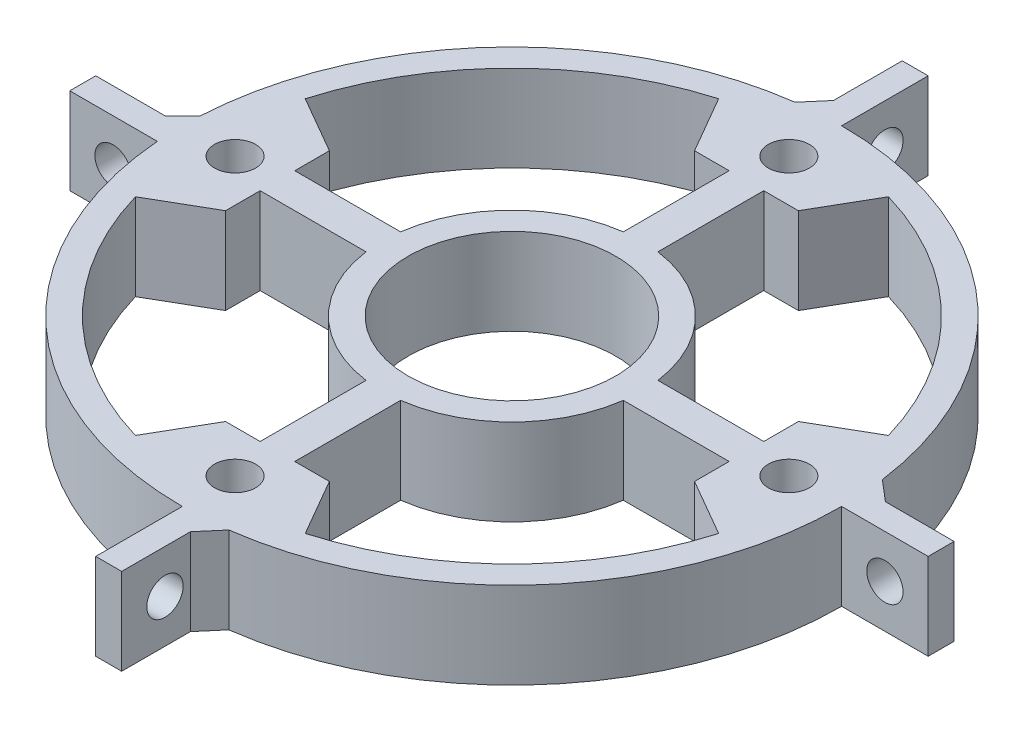
from build123d import *

# Parameters (mm, degrees)
SKETCH1_R           = 38.1
SKETCH1_R_2         = 35.1
EXTRUDE_THIN1_DEPTH = 5
BOSS_EXTRUDE1_START = -10
BOSS_EXTRUDE1_DEPTH = 10
SKETCH3_R           = 2.375
CUT_EXTRUDE1_DEPTH  = 10
CIRPATTERN1_COUNT   = 4
SKETCH4_W           = 11
SKETCH4_H           = 10
BOSS_EXTRUDE2_DEPTH = 3
SKETCH5_R           = 2.1
CUT_EXTRUDE2_DEPTH  = 3
CIRPATTERN2_COUNT   = 4
CHAMFER1_SIZE       = 2.178281406
CHAMFER1_SIZE_2     = 2
SKETCH6_R           = 12
BOSS_EXTRUDE3_DEPTH = 5


with BuildPart() as part:
    # Sketch1 → Extrude-Thin1 (new, symmetric)
    with BuildSketch(Plane(origin=(0, 0, 0), x_dir=(1, 0, 0), z_dir=(0, 1, 0))):
        Circle(SKETCH1_R)
        Circle(SKETCH1_R_2, mode=Mode.SUBTRACT)
    extrude(amount=EXTRUDE_THIN1_DEPTH, both=True)

    # Sketch2 → Boss-Extrude1 (add)
    with BuildSketch(Plane(origin=(0, 5, 0), x_dir=(1, 0, 0), z_dir=(0, 1, 0)).offset(BOSS_EXTRUDE1_START)):
        with BuildLine():
            Line((-27.1, 6), (-27.1, -6))
            Line((-27.1, -6), (-33.700938133, -9.811053408))
            ThreePointArc((-33.700938133, -9.811053408), (-35.1, 0), (-33.700938133, 9.811053408))
            Line((-33.700938133, 9.811053408), (-27.1, 6))
        make_face()
    boss_extrude1 = extrude(amount=BOSS_EXTRUDE1_DEPTH)

    # Sketch3 → Cut-Extrude1 (cut)
    with BuildSketch(Plane(origin=(0, 5, 0), x_dir=(1, 0, 0), z_dir=(0, 1, 0))):
        with Locations(Location((-32, 0, 0), (0, 0, 270))):
            Circle(SKETCH3_R)
    cut_extrude1 = extrude(amount=-CUT_EXTRUDE1_DEPTH, mode=Mode.SUBTRACT)

    # CirPattern1: Boss-Extrude1, Cut-Extrude1 ×4 about axis
    cirpattern1_axis = Axis((0, 0, 0), (0, 1, 0))
    add([boss_extrude1.rotate(cirpattern1_axis, i * 360 / CIRPATTERN1_COUNT) for i in range(1, CIRPATTERN1_COUNT)])
    add([cut_extrude1.rotate(cirpattern1_axis, i * 360 / CIRPATTERN1_COUNT) for i in range(1, CIRPATTERN1_COUNT)], mode=Mode.SUBTRACT)

    # Sketch4 → Boss-Extrude2 (add)
    with BuildSketch(Plane.XY):
        with Locations((-42.6, 0)):
            Rectangle(SKETCH4_W, SKETCH4_H)
    boss_extrude2 = extrude(amount=BOSS_EXTRUDE2_DEPTH)

    # Sketch5 → Cut-Extrude2 (cut)
    with BuildSketch(Plane(origin=(0, 0, 0), x_dir=(-1, 0, 0), z_dir=(0, 0, -1))):
        with Locations((43.1, 0)):
            Circle(SKETCH5_R)
    cut_extrude2 = extrude(amount=-CUT_EXTRUDE2_DEPTH, mode=Mode.SUBTRACT)

    # CirPattern2: Boss-Extrude2, Cut-Extrude2 ×4 about axis
    cirpattern2_axis = Axis((0, 0, 0), (0, 1, 0))
    add([boss_extrude2.rotate(cirpattern2_axis, i * 360 / CIRPATTERN2_COUNT) for i in range(1, CIRPATTERN2_COUNT)])
    add([cut_extrude2.rotate(cirpattern2_axis, i * 360 / CIRPATTERN2_COUNT) for i in range(1, CIRPATTERN2_COUNT)], mode=Mode.SUBTRACT)

    # Chamfer1
    # the kernel refuses this chamfer: 2.178281406, 2 mm, written as the material it adds along each edge
    with BuildSketch(Plane(origin=(-3, -5, -37.981706123), x_dir=(-0.9944073694019739, 0, 0.10561242199214178), z_dir=(0, 1, 0))) as chamfer1_piece_1:
        with BuildLine():
            Line((2.056235734, 0), (-CHAMFER1_SIZE * 0.105612421996, -CHAMFER1_SIZE * 0.994407369435))
            Line((-CHAMFER1_SIZE * 0.105612421996, -CHAMFER1_SIZE * 0.994407369435), (0, 0))
            ThreePointArc((0, 0), (1.059779898, -0.013861107), (2.056235734, 0))
        make_face()
    extrude(amount=10)
    with BuildSketch(Plane(origin=(37.981706123, -5, -3), x_dir=(1, 0, 0), z_dir=(0, 1, 0)), Plane(origin=(3, -5, 37.981706123), x_dir=(0, 0, 1), z_dir=(0, 1, 0))) as chamfer1_piece_2:
        with BuildLine():
            Line((CHAMFER1_SIZE, 0), (-0.217164036, 2.044735967))
            ThreePointArc((-0.217164036, 2.044735967), (-0.098142335, 1.055316846), (0, 0))
            Line((0, 0), (CHAMFER1_SIZE, 0))
        make_face()
    extrude(amount=10)
    with BuildSketch(Plane(origin=(-38.1, -5, 0), x_dir=(0.026984720913872013, 0, -0.9996358461145741), z_dir=(0, 1, 0))) as chamfer1_piece_3:
        with BuildLine():
            Line((2.056235734, 0), (-CHAMFER1_SIZE_2 * 0.0269847209139, CHAMFER1_SIZE_2 * 0.999635846115))
            Line((-CHAMFER1_SIZE_2 * 0.0269847209139, CHAMFER1_SIZE_2 * 0.999635846115), (0, 0))
            ThreePointArc((0, 0), (1.057186648, 0.013863174), (2.056235734, 0))
        make_face()
    extrude(amount=10)

    # Sketch6 → Boss-Extrude3 (add, symmetric)
    with BuildSketch(Plane(origin=(0, 0, 0), x_dir=(1, 0, 0), z_dir=(0, 1, 0))):
        with BuildLine():
            Line((-2, 27.1), (-2, 14.866068747))
            ThreePointArc((-2, 14.866068747), (-10.606601718, 10.606601718), (-14.866068747, 2))
            Line((-14.866068747, 2), (-27.1, 2))
            Line((-27.1, 2), (-27.1, -2))
            Line((-27.1, -2), (-14.866068747, -2))
            ThreePointArc((-14.866068747, -2), (-10.606601718, -10.606601718), (-2, -14.866068747))
            Line((-2, -14.866068747), (-2, -27.1))
            Line((-2, -27.1), (2, -27.1))
            Line((2, -27.1), (2, -14.866068747))
            ThreePointArc((2, -14.866068747), (10.606601718, -10.606601718), (14.866068747, -2))
            Line((14.866068747, -2), (27.1, -2))
            Line((27.1, -2), (27.1, 2))
            Line((27.1, 2), (14.866068747, 2))
            ThreePointArc((14.866068747, 2), (10.606601718, 10.606601718), (2, 14.866068747))
            Line((2, 14.866068747), (2, 27.1))
            Line((2, 27.1), (-2, 27.1))
        make_face()
        with Locations(Location((0, 0, 0), (0, 0, 270))):
            Circle(SKETCH6_R, mode=Mode.SUBTRACT)
    extrude(amount=BOSS_EXTRUDE3_DEPTH, both=True)


solid = part.part
